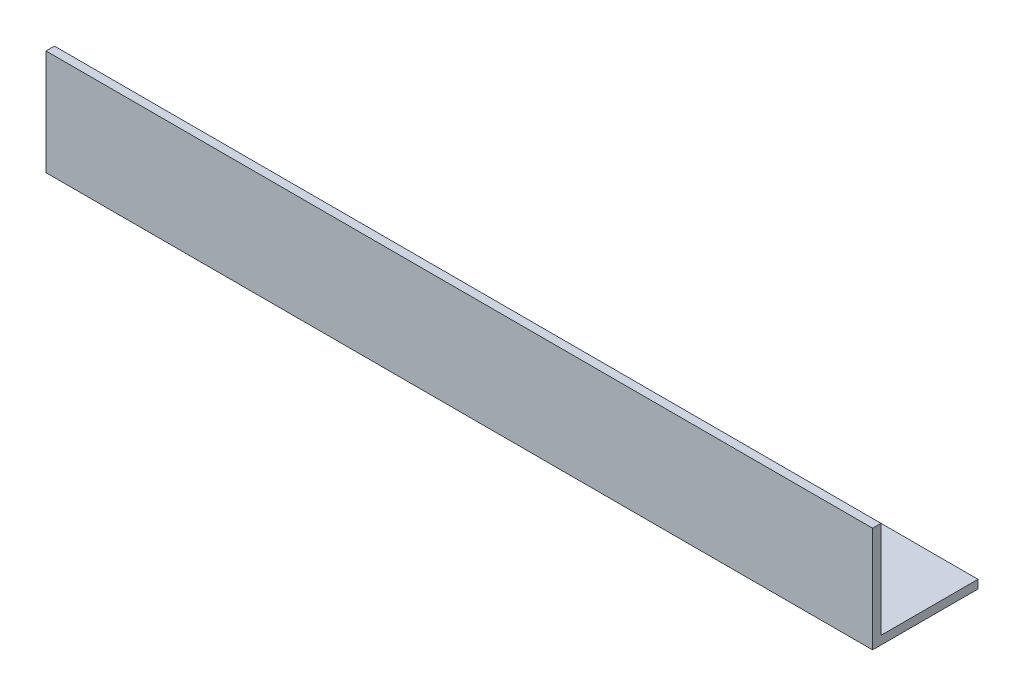
from build123d import *

# Parameters (mm, degrees)
EXTRUDE_1_DEPTH = 196


with BuildPart() as part:
    # Эскиз1 → Вытянуть-Тонкостенный1 (new body)
    with BuildSketch(Plane(origin=(0, 0, 0), x_dir=(0, 0, -1), z_dir=(1, 0, 0))):
        Polygon((0, 25), (0, 0), (25, 0), (25, 2), (2, 2), (2, 25), align=None)
    extrude(amount=EXTRUDE_1_DEPTH)


solid = part.part
